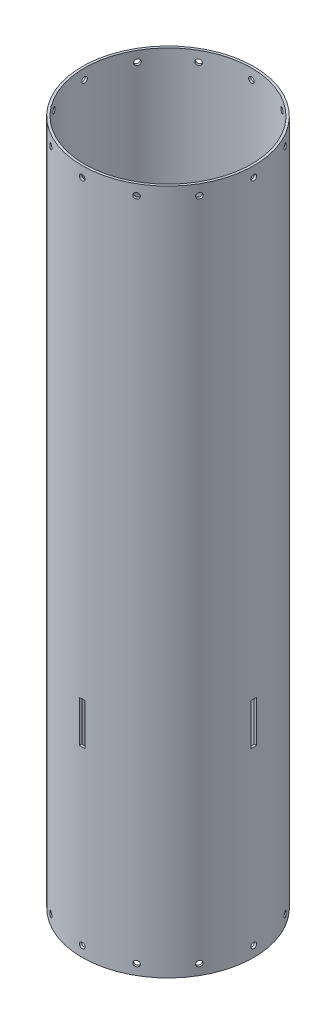
from build123d import *

# Parameters (mm, degrees)
SKETCH1_R           = 78.359
SKETCH1_R_2         = 76.2
BOSS_EXTRUDE1_DEPTH = 626.11
SKETCH2_R           = 2.54
CUT_EXTRUDE1_DEPTH  = 636.841173456
CIRPATTERN1_COUNT   = 12
SKETCH3_W           = 5.08
SKETCH3_H           = 38.1
CUT_EXTRUDE2_DEPTH  = 636.841173581
CIRPATTERN2_COUNT   = 4


with BuildPart() as part:
    # Sketch1 → Boss-Extrude1 (new body)
    with BuildSketch(Plane(origin=(0, 0, 0), x_dir=(1, 0, 0), z_dir=(0, 1, 0))):
        Circle(SKETCH1_R)
        Circle(SKETCH1_R_2, mode=Mode.SUBTRACT)
    extrude(amount=BOSS_EXTRUDE1_DEPTH)

    # Sketch2 → Cut-Extrude1 (cut, through all)
    with BuildSketch(Plane.XY):
        with Locations((0, 9.525)):
            Circle(SKETCH2_R)
        with Locations((0, 616.585)):
            Circle(SKETCH2_R)
    cut_extrude1 = extrude(amount=-CUT_EXTRUDE1_DEPTH, mode=Mode.SUBTRACT)

    # CirPattern1: Cut-Extrude1 ×12 about axis
    cirpattern1_axis = Axis((0, 0, 0), (0, 1, 0))
    for i in range(1, CIRPATTERN1_COUNT):
        add(cut_extrude1.rotate(cirpattern1_axis, i * 360 / CIRPATTERN1_COUNT), mode=Mode.SUBTRACT)

    # Sketch3 → Cut-Extrude2 (cut, through all)
    with BuildSketch(Plane.XY):
        with Locations((0, 185.42)):
            Rectangle(SKETCH3_W, SKETCH3_H)
    cut_extrude2 = extrude(amount=-CUT_EXTRUDE2_DEPTH, mode=Mode.SUBTRACT)

    # CirPattern2: Cut-Extrude2 ×4 about axis
    cirpattern2_axis = Axis((0, 626.11, 0), (0, -1, 0))
    for i in range(1, CIRPATTERN2_COUNT):
        add(cut_extrude2.rotate(cirpattern2_axis, i * 360 / CIRPATTERN2_COUNT), mode=Mode.SUBTRACT)


solid = part.part
